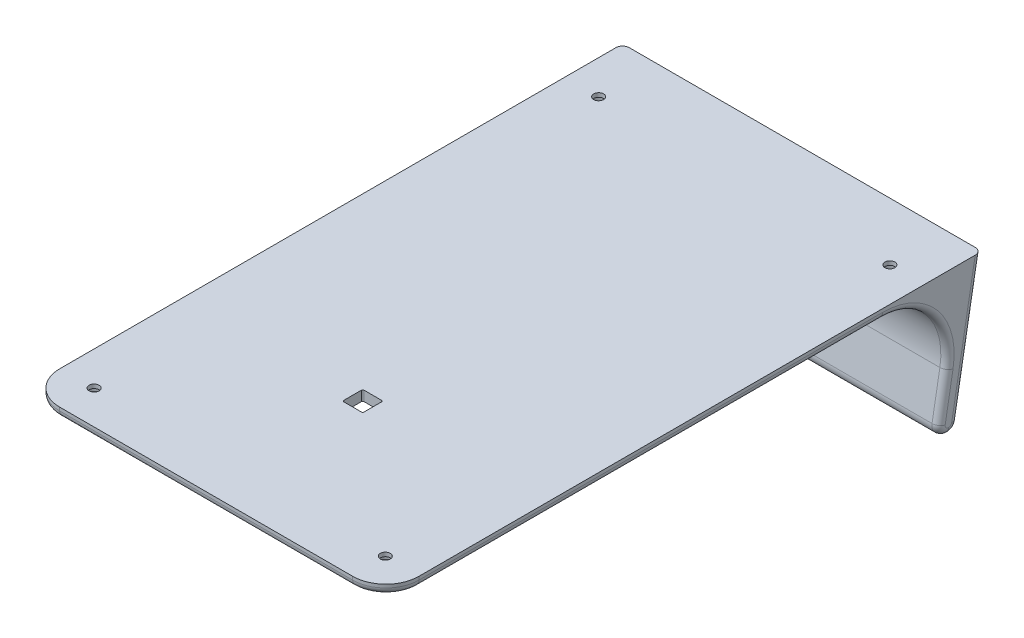
from build123d import *

# Parameters (mm, degrees)
BOSS_EXTRUDE1_DEPTH = 1.5
SKETCH3_W           = 54.19363593
SKETCH3_H           = 15
BOSS_EXTRUDE2_DEPTH = 20
CUT_EXTRUDE2_DEPTH  = 107.861890415
CUT_EXTRUDE4_DEPTH  = 107.861890415
FILLET1_R           = 1.5
SKETCH7_R           = 0.75
CUT_EXTRUDE5_DEPTH  = 109.286974912
SKETCH9_R           = 1.5
CUT_EXTRUDE6_DEPTH  = 5.9
FILLET2_R           = 1
CUT_EXTRUDE7_DEPTH  = 110.092020548


with BuildPart() as part:
    # Sketch1 → Boss-Extrude1 (new body)
    with BuildSketch(Plane(origin=(0, 0, 0), x_dir=(1, 0, 0), z_dir=(0, 1, 0))):
        with BuildLine():
            Line((9.274778516, 0), (53.468414446, 0))
            ThreePointArc((53.468414446, 0), (57.003948352, 1.464466094), (58.468414446, 5))
            Line((58.468414446, 5), (58.468414446, 89.9028))
            Line((58.468414446, 89.9028), (4.274778516, 89.9028))
            Line((4.274778516, 89.9028), (4.274778516, 5))
            ThreePointArc((4.274778516, 5), (5.73924461, 1.464466094), (9.274778516, 0))
        make_face()
    extrude(amount=BOSS_EXTRUDE1_DEPTH)

    # Sketch3 → Boss-Extrude2 (add)
    with BuildSketch(Plane.XZ):
        with Locations((31.371596481, -82.4028)):
            Rectangle(SKETCH3_W, SKETCH3_H)
    extrude(amount=BOSS_EXTRUDE2_DEPTH)

    # Sketch2 → Cut-Extrude2 (cut, through all)
    with BuildSketch(Plane(origin=(58.468414446, 0, 0), x_dir=(0, 0, -1), z_dir=(1, 0, 0))):
        Polygon((89.9028, 1.5), (86.111769915, -20), (89.9028, -20), align=None)
    extrude(amount=-CUT_EXTRUDE2_DEPTH, mode=Mode.SUBTRACT)

    # Sketch4 → Cut-Extrude4 (cut, through all)
    with BuildSketch(Plane.ZY.offset(-4.274778516)):
        with BuildLine():
            Line((-74.9028, 0), (-74.9028, -20))
            Line((-74.9028, -20), (-83.065490079, -20))
            Line((-83.065490079, -20), (-84.562216259, -11.511644029))
            ThreePointArc((-84.562216259, -11.511644029), (-82.416492014, -3.503692127), (-74.9028, 0))
        make_face()
    extrude(amount=-CUT_EXTRUDE4_DEPTH, mode=Mode.SUBTRACT)

    # Fillet1
    fillet1_edges = [part.edges().sort_by_distance(p)[0] for p in [
        (31.371596481, -20, -86.111769915),
        (31.371596481, -20, -83.065490079),
    ]]
    fillet(fillet1_edges, radius=FILLET1_R - 0.0001)  # a hair under: the kernel refuses the full size

    # Sketch7 → Cut-Extrude5 (cut, through all)
    with BuildSketch(Plane(origin=(0, -5, 0), x_dir=(-1, 0, 0), z_dir=(0, -1, 0))):
        with Locations(Location((-53.302878516, 5.0861, 0), (0, 0, 90))):
            Circle(SKETCH7_R)
        with Locations(Location((-9.386278516, 5.0861, 0), (0, 0, 90))):
            Circle(SKETCH7_R)
        with Locations(Location((-9.386278516, 81.1845, 0), (0, 0, 90))):
            Circle(SKETCH7_R)
        with Locations(Location((-53.302878516, 81.1845, 0), (0, 0, 90))):
            Circle(SKETCH7_R)
    extrude(amount=-CUT_EXTRUDE5_DEPTH, mode=Mode.SUBTRACT)

    # Sketch9 → Cut-Extrude6 (cut)
    with BuildSketch(Plane(origin=(0, -5, 0), x_dir=(-1, 0, 0), z_dir=(0, -1, 0))):
        with Locations(Location((-53.302878516, 5.0861, 0), (0, 0, 90))):
            Circle(SKETCH9_R)
        with Locations(Location((-9.386278516, 5.0861, 0), (0, 0, 90))):
            Circle(SKETCH9_R)
        with Locations(Location((-9.386278516, 81.1845, 0), (0, 0, 90))):
            Circle(SKETCH9_R)
        with Locations(Location((-53.302878516, 81.1845, 0), (0, 0, 90))):
            Circle(SKETCH9_R)
    extrude(amount=-CUT_EXTRUDE6_DEPTH, mode=Mode.SUBTRACT)

    # Fillet2
    fillet2_edges = [part.edges().sort_by_distance(p)[0] for p in [
        (4.274778516, 0, -39.9514),
        (4.274778516, -8.630277451, -88.116558763),
        (58.468414446, -8.630277451, -88.116558763),
        (58.468414446, -3.503692127, -82.416492014),
        (58.468414446, -14.875644564, -83.969052201),
        (4.274778516, -3.503692127, -82.416492014),
        (4.274778516, -14.875644564, -83.969052201),
        (58.468414446, -19.464217136, -83.704011232),
        (58.468414446, -19.64909006, -85.817321514),
        (4.274778516, -19.464217136, -83.704011232),
        (4.274778516, -19.64909006, -85.817321514),
        (57.003948352, 0, -1.464466094),
        (31.371596481, 0, 0),
        (5.73924461, 0, -1.464466094),
        (58.468414446, 0, -39.9514),
    ]]
    fillet(fillet2_edges, radius=FILLET2_R)

    # Sketch10 → Cut-Extrude7 (cut, through all)
    with BuildSketch(Plane.XZ):
        with BuildLine():
            Line((32.669578516, -22.1128), (30.019578516, -22.1128))
            ThreePointArc((30.019578516, -22.1128), (29.87815716, -22.171378644), (29.819578516, -22.3128))
            Line((29.819578516, -22.3128), (29.819578516, -24.9628))
            ThreePointArc((29.819578516, -24.9628), (29.87815716, -25.104221356), (30.019578516, -25.1628))
            Line((30.019578516, -25.1628), (32.669578516, -25.1628))
            ThreePointArc((32.669578516, -25.1628), (32.810999872, -25.104221356), (32.869578516, -24.9628))
            Line((32.869578516, -24.9628), (32.869578516, -22.3128))
            ThreePointArc((32.869578516, -22.3128), (32.810999872, -22.171378644), (32.669578516, -22.1128))
        make_face()
    extrude(amount=-CUT_EXTRUDE7_DEPTH, mode=Mode.SUBTRACT)


solid = part.part
